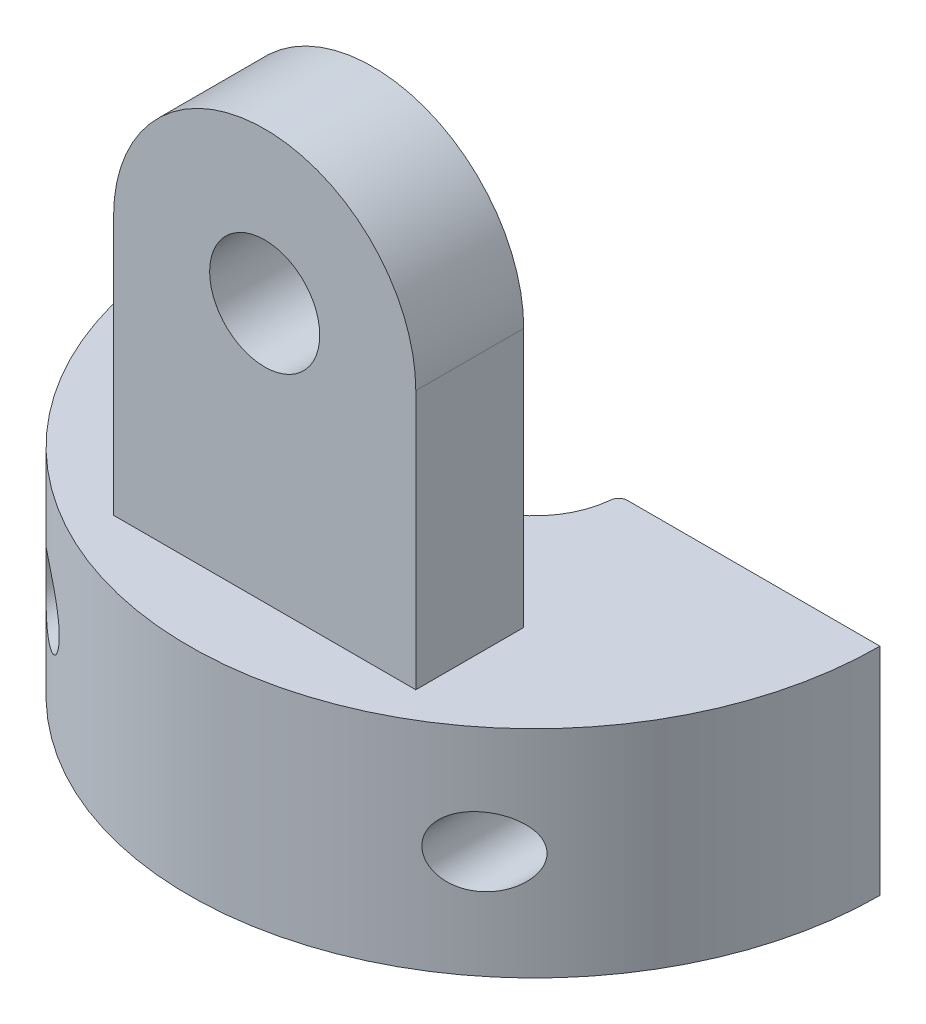
from build123d import *

# Parameters (mm, degrees)
BOSS_EXTRUDE1_DEPTH   = 2.5
SKETCH2_W             = 7
SKETCH2_H             = 2.5
BOSS_EXTRUDE2_DEPTH   = 9.5
CUT_EXTRUDE1_DEPTH    = 9.5
SKETCH4_R             = 1.275
CUT_EXTRUDE2_DEPTH    = 9.5
M2X0_4_TAPPED_HOLE1_D = 1.6
FILLET1_R             = 0.2


with BuildPart() as part:
    # Sketch1 → Boss-Extrude1 (new, symmetric)
    with BuildSketch(Plane(origin=(0, 0, 0), x_dir=(1, 0, 0), z_dir=(0, 1, 0))):
        with BuildLine():
            Line((1.96, 0), (8, 0))
            ThreePointArc((8, 0), (0, -8), (-8, 0))
            Line((-8, 0), (-1.96, 0))
            ThreePointArc((-1.96, 0), (0, -1.96), (1.96, 0))
        make_face()
    extrude(amount=BOSS_EXTRUDE1_DEPTH, both=True)

    # Sketch2 → Boss-Extrude2 (add)
    with BuildSketch(Plane(origin=(0, 2.5, 0), x_dir=(1, 0, 0), z_dir=(0, 1, 0))):
        with Locations((0, -5)):
            Rectangle(SKETCH2_W, SKETCH2_H)
    extrude(amount=BOSS_EXTRUDE2_DEPTH)

    # Sketch3 → Cut-Extrude1 (cut)
    with BuildSketch(Plane(origin=(0, 0, 3.75), x_dir=(-1, 0, 0), z_dir=(0, 0, -1))):
        with BuildLine():
            Line((-3.5, 8.5), (-3.5, 14.886359519))
            Line((-3.5, 14.886359519), (0, 16.809201746))
            Line((0, 16.809201746), (3.5, 14.5))
            Line((3.5, 14.5), (3.5, 8.5))
            ThreePointArc((3.5, 8.5), (0, 12), (-3.5, 8.5))
        make_face()
    extrude(amount=-CUT_EXTRUDE1_DEPTH, mode=Mode.SUBTRACT)

    # Sketch4 → Cut-Extrude2 (cut)
    with BuildSketch(Plane(origin=(0, 0, 3.75), x_dir=(-1, 0, 0), z_dir=(0, 0, -1))):
        with Locations((0, 8.5)):
            Circle(SKETCH4_R)
    extrude(amount=-CUT_EXTRUDE2_DEPTH, mode=Mode.SUBTRACT)

    # M2x0.4 Tapped Hole1 (through all)
    with Locations(Plane(origin=(0, 0, 0), x_dir=(-1, 0, 0), z_dir=(0, 0, -1))):
        with Locations((-5, 0), (5, 0)):
            Hole(M2X0_4_TAPPED_HOLE1_D / 2)

    # Fillet1
    fillet1_edges = [part.edges().sort_by_distance(p)[0] for p in [
        (-1.96, 0, 0),
        (1.96, 0, 0),
    ]]
    fillet(fillet1_edges, radius=FILLET1_R)


solid = part.part
